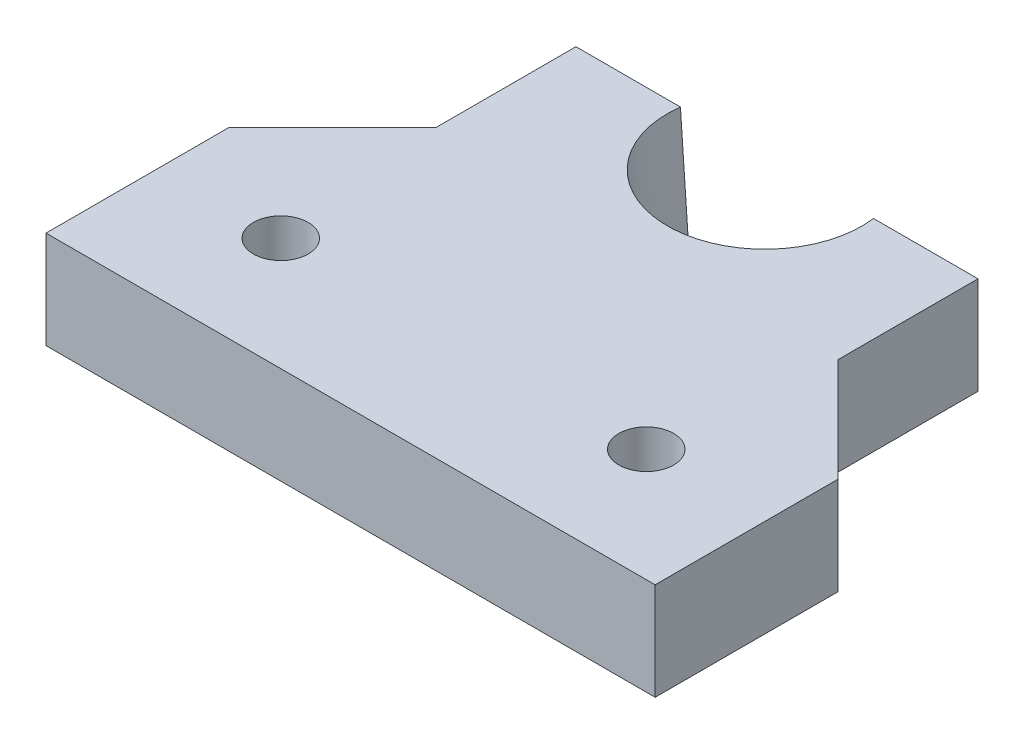
from build123d import *

# Parameters (mm, degrees)
BOSS_EXTRUDE1_DEPTH                     = 8
SKETCH2_W                               = 20
SKETCH2_H                               = 20
BOSS_EXTRUDE2_DEPTH                     = 2
FILLET1_R                               = 10
SKETCH3_R                               = 7.29
CUT_EXTRUDE1_DEPTH                      = 37.020349658
CUT_EXTRUDE1_DRAFT                      = 4
CBORE_FOR_M5_HEX_HEAD_BOLT1_D           = 4.5
CBORE_FOR_M5_HEX_HEAD_BOLT1_CBORE_D     = 10
CBORE_FOR_M5_HEX_HEAD_BOLT1_CBORE_DEPTH = 3


with BuildPart() as part:
    # Sketch1 → Boss-Extrude1 (new body)
    with BuildSketch(Plane(origin=(0, 0, 0), x_dir=(1, 0, 0), z_dir=(0, 1, 0))):
        Polygon((-25, 3.926253144), (-25, -11.073746856), (25, -11.073746856), (25, 3.926253144), (16.5, 12.426253144), (16.5, 23.926253144), (-16.5, 23.926253144), (-16.5, 12.426253144), align=None)
    extrude(amount=BOSS_EXTRUDE1_DEPTH)

    # Sketch2 → Boss-Extrude2 (add)
    with BuildSketch(Plane.XZ):
        with Locations((0, -13.926253144)):
            Rectangle(SKETCH2_W, SKETCH2_H)
    extrude(amount=BOSS_EXTRUDE2_DEPTH)

    # Fillet1
    fillet1_edges = [part.edges().sort_by_distance(p)[0] for p in [
        (-10, -1, -3.926253144),
        (10, -1, -3.926253144),
    ]]
    fillet(fillet1_edges, radius=FILLET1_R - 0.0001)  # a hair under: the kernel refuses the full size


with BuildPart() as cut_extrude1_tool:
    # Sketch3 → Cut-Extrude1 (with draft: the straight prism first)
    with BuildSketch(Plane.XZ.offset(2)):
        with Locations((0, -22.926253144)):
            Circle(SKETCH3_R)
    extrude(amount=-CUT_EXTRUDE1_DEPTH)
    # Cut-Extrude1: the draft: its side faces are tilted about the plane it starts from
    cut_extrude1_sides = [cut_extrude1_tool.faces().sort_by_distance(p)[0] for p in [
        (-7.29, 16.510174829, -22.926253144),
    ]]
    draft(cut_extrude1_sides, Plane.XZ.offset(2), CUT_EXTRUDE1_DRAFT)


with BuildPart() as part_1:
    add(part.part)

    # Cut-Extrude1: cut by cut_extrude1_tool
    add(cut_extrude1_tool.part, mode=Mode.SUBTRACT)

    # CBORE for M5 Hex Head Bolt1 (through all)
    with Locations(Plane(origin=(-15, 0, 1.804006093), x_dir=(0, 0, -1), z_dir=(0, -1, 0))):
        with Locations((0, 0), (0, 30)):
            CounterBoreHole(CBORE_FOR_M5_HEX_HEAD_BOLT1_D / 2, CBORE_FOR_M5_HEX_HEAD_BOLT1_CBORE_D / 2, CBORE_FOR_M5_HEX_HEAD_BOLT1_CBORE_DEPTH)


solid = part_1.part
